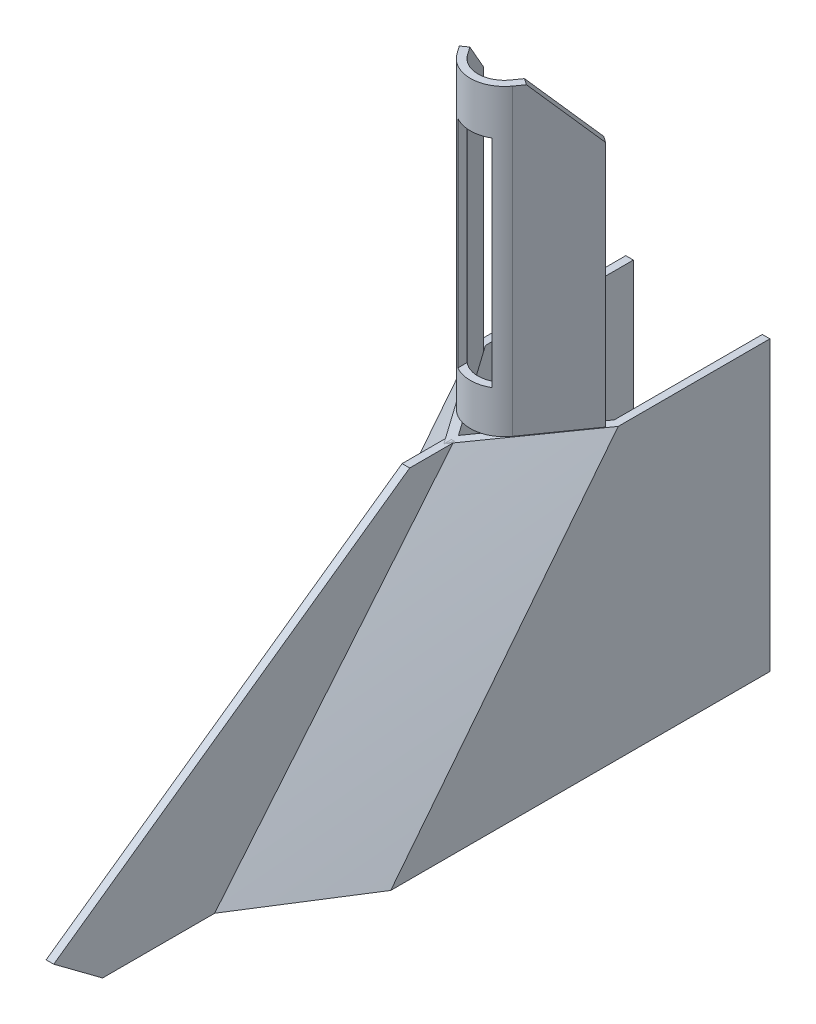
from build123d import *

# Parameters (mm, degrees)
SHELL_1_T                = -2
EXTRUDE_1_DEPTH          = 1
EXTRUDE_1_DEPTH_BACK     = 1
MOVE_START               = -1
MOVE_FACE_1_DEPTH        = 2
EXTRUDE_2_DEPTH          = 80
CHAMFER_1_SIZE           = 15
CUT_EXTRUDE_1_DEPTH      = 204.953426129
CUT_EXTRUDE_1_DEPTH_BACK = 204.953426129
SKETCH_5_W               = 9
SKETCH_5_H               = 57


# Read off the part's stored shape, not the designer's step: Переместить грань1
with BuildPart() as part:
    # Эскиз2 → По сечениям2 section 0
    with BuildSketch(Plane(origin=(0, 76, 0), x_dir=(1, 0, 0), z_dir=(0, 1, 0))):
        with BuildLine():
            Line((-19, 130), (19, 130))
            Line((19, 130), (19, 90))
            Line((19, 90), (0, 63))
            Line((0, 63), (-19, 90))
            Line((-19, 90), (-19, 130))
        make_face()
    # Эскиз1 → По сечениям2 section 1
    with BuildSketch(Plane(origin=(0, 0, 0), x_dir=(1, 0, 0), z_dir=(0, 1, 0))):
        with BuildLine():
            Line((0, 0), (19, 30))
            Line((19, 30), (19, 130))
            Line((19, 130), (-19, 130))
            Line((-19, 130), (-19, 30))
            Line((-19, 30), (0, 0))
        make_face()
    loft()

    # Оболочка1
    shell_1_openings = [part.faces().sort_by_distance(p)[0] for p in [
        (0, 0, -72.173913043),
        (0, 76, -102.682242991),
        (0, 38, -130),
    ]]
    offset(amount=SHELL_1_T, openings=shell_1_openings, kind=Kind.INTERSECTION)

    # Эскиз4 → Бобышка-Вытянуть2 (add)
    with BuildSketch(Plane(origin=(0, 76, 0), x_dir=(1, 0, 0), z_dir=(0, 1, 0))):
        with BuildLine():
            Line((5.722299686, 74.96948221), (15.84807873, 89.340970111))
            Line((15.84807873, 89.340970111), (17.483021498, 88.189031681))
            Line((17.483021498, 88.189031681), (7.357242454, 73.81754378))
            ThreePointArc((7.357242454, 73.81754378), (0, 70.001266716), (-7.357242454, 73.81754378))
            Line((-7.357242454, 73.81754378), (-17.483021498, 88.189031681))
            Line((-17.483021498, 88.189031681), (-15.84807873, 89.340970111))
            Line((-15.84807873, 89.340970111), (-5.722299686, 74.96948221))
            ThreePointArc((-5.722299686, 74.96948221), (0, 72.001266716), (5.722299686, 74.96948221))
        make_face()
    extrude(amount=EXTRUDE_2_DEPTH)

    # Фаска1
    chamfer_1_edges = [part.edges().sort_by_distance(p)[0] for p in [
        (-16.665550114, 156, -88.765000896),
        (16.665550114, 156, -88.765000896),
    ]]
    chamfer(chamfer_1_edges, length=CHAMFER_1_SIZE)

    # Эскиз5 → Вырез-Вытянуть1 (cut, two sides: drawn at the far end of the back side and taken through both)
    with BuildSketch(Plane.XY.offset(-CUT_EXTRUDE_1_DEPTH_BACK)):
        with Locations((0, 115.5)):
            Rectangle(SKETCH_5_W, SKETCH_5_H)
    extrude(amount=CUT_EXTRUDE_1_DEPTH + CUT_EXTRUDE_1_DEPTH_BACK, mode=Mode.SUBTRACT)


with BuildPart() as body_2:
    # Эскиз3 → Бобышка-Вытянуть1 (new, two sides: drawn at the far end of the back side and taken through both)
    with BuildSketch(Plane(origin=(0, 0, 0), x_dir=(0, 0, -1), z_dir=(1, 0, 0)).offset(-EXTRUDE_1_DEPTH_BACK)):
        Polygon((63, 76), (53, 76), (-40.891415979, 9.596671729), (-28, 0), (0, 0), align=None)
    extrude(amount=EXTRUDE_1_DEPTH + EXTRUDE_1_DEPTH_BACK)

    # Move Face 1 outline → Move Face 1 (add)
    with BuildSketch(Plane.YZ.offset(MOVE_START)):
        Polygon((0, 0), (0, -2), (76, -65), (76, -63), align=None)
    extrude(amount=MOVE_FACE_1_DEPTH)


solid = Compound([part.part, body_2.part])
